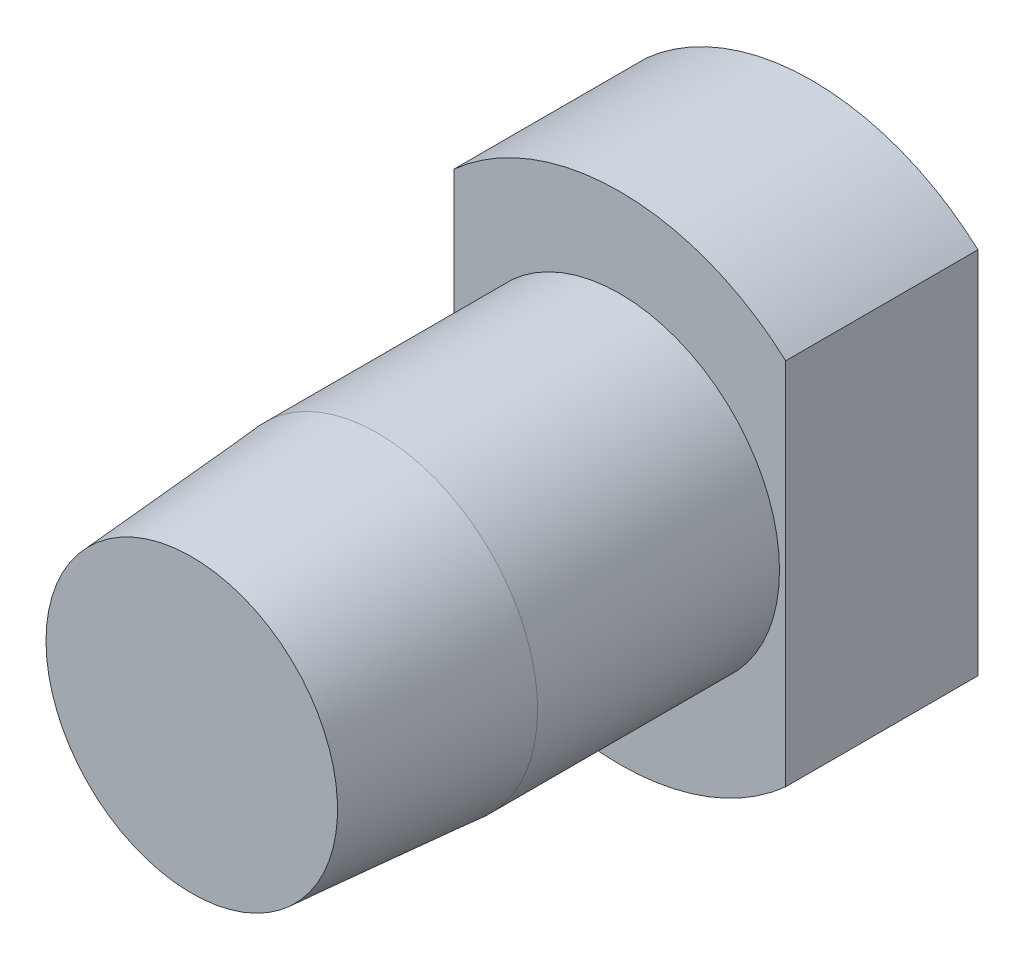
from build123d import *

# Parameters (mm, degrees)
SKETCH2_W          = 2.584728437
SKETCH2_H          = 8.43239663
CUT_EXTRUDE1_DEPTH = 12.489125293


with BuildPart() as part:
    # Sketch1 → Revolve1 (revolve)
    with BuildSketch(Plane(origin=(0, 0, 0), x_dir=(0, 0, -1), z_dir=(1, 0, 0))):
        Polygon((0, 0), (0, 2.35), (3, 2.575), (6.9, 2.575), (6.9, 4), (10, 4), (10, 2.25), (7.75, 0), align=None)
    revolve(axis=Axis((0, 0, 0), (0, 0, -1)))

    # Sketch2 → Cut-Extrude1 (cut, through all)
    with BuildSketch(Plane(origin=(0, 0, -10), x_dir=(-1, 0, 0), z_dir=(0, 0, -1))):
        with Locations((3.967364219, 0)):
            Rectangle(SKETCH2_W, SKETCH2_H)
        with Locations((-3.967364219, 0)):
            Rectangle(SKETCH2_W, SKETCH2_H)
    extrude(amount=-CUT_EXTRUDE1_DEPTH, mode=Mode.SUBTRACT)


solid = part.part
